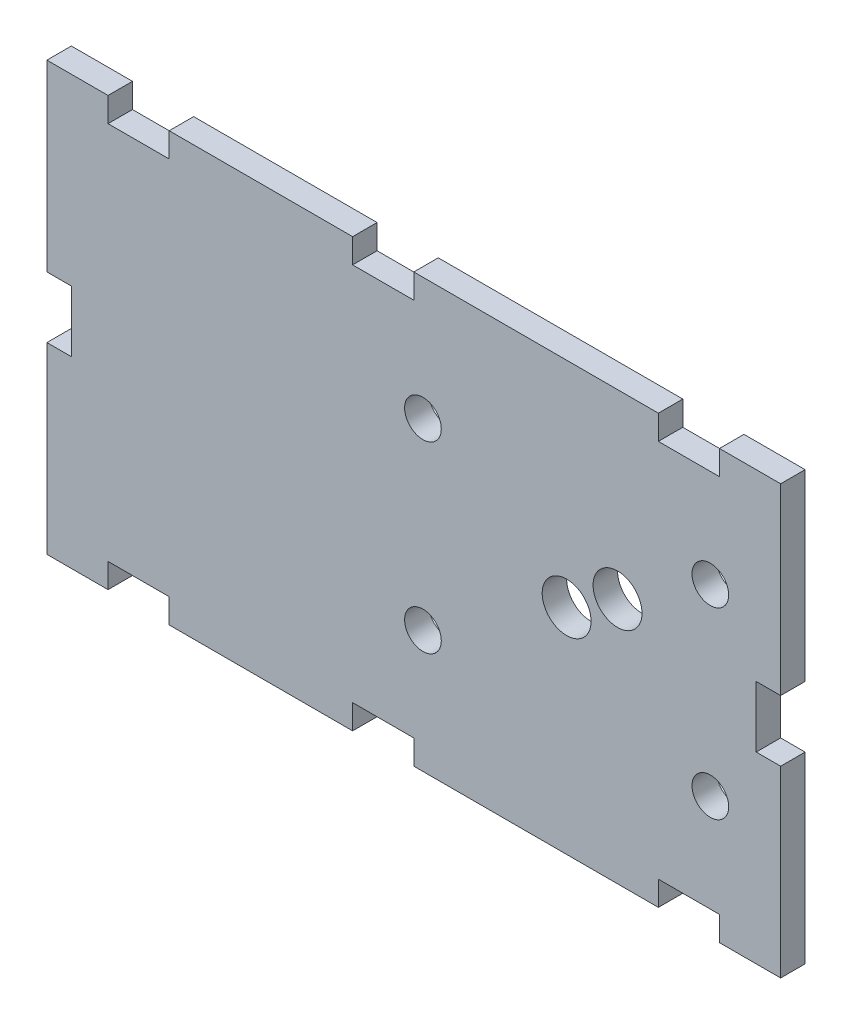
from build123d import *

# Parameters (mm, degrees)
SKETCH1_W           = 120
SKETCH1_H           = 70
BOSS_EXTRUDE1_DEPTH = 4
SKETCH2_R           = 4
SKETCH2_R_2         = 3
CUT_EXTRUDE1_DEPTH  = 4
SKETCH3_R           = 4
CUT_EXTRUDE2_DEPTH  = 4
SKETCH4_W           = 10
SKETCH4_H           = 4
SKETCH4_W_2         = 4
SKETCH4_H_2         = 10
CUT_EXTRUDE3_DEPTH  = 4


with BuildPart() as part:
    # Sketch1 → Boss-Extrude1 (new body)
    with BuildSketch(Plane.XY):
        with Locations((60, 35)):
            Rectangle(SKETCH1_W, SKETCH1_H)
    extrude(amount=BOSS_EXTRUDE1_DEPTH)

    # Sketch2 → Cut-Extrude1 (cut)
    with BuildSketch(Plane.XY.offset(4)):
        with Locations((85, 35)):
            Circle(SKETCH2_R)
        with Locations((108.5, 50)):
            Circle(SKETCH2_R_2)
        with Locations((108.5, 20)):
            Circle(SKETCH2_R_2)
        with Locations((61.5, 20)):
            Circle(SKETCH2_R_2)
        with Locations((61.5, 50)):
            Circle(SKETCH2_R_2)
    extrude(amount=-CUT_EXTRUDE1_DEPTH, mode=Mode.SUBTRACT)

    # Sketch3 → Cut-Extrude2 (cut)
    with BuildSketch(Plane.XY.offset(4)):
        with Locations((93.322796237, 40.31242313)):
            Circle(SKETCH3_R)
    extrude(amount=-CUT_EXTRUDE2_DEPTH, mode=Mode.SUBTRACT)

    # Sketch4 → Cut-Extrude3 (cut)
    with BuildSketch(Plane.XY.offset(4)):
        with Locations((15, 2)):
            Rectangle(SKETCH4_W, SKETCH4_H)
        with Locations((55, 2)):
            Rectangle(SKETCH4_W, SKETCH4_H)
        with Locations((2, 35)):
            Rectangle(SKETCH4_W_2, SKETCH4_H_2)
        with Locations((105, 2)):
            Rectangle(SKETCH4_W, SKETCH4_H)
        with Locations((15, 68)):
            Rectangle(SKETCH4_W, SKETCH4_H)
        with Locations((118, 35)):
            Rectangle(SKETCH4_W_2, SKETCH4_H_2)
        with Locations((55, 68)):
            Rectangle(SKETCH4_W, SKETCH4_H)
        with Locations((105, 68)):
            Rectangle(SKETCH4_W, SKETCH4_H)
    extrude(amount=-CUT_EXTRUDE3_DEPTH, mode=Mode.SUBTRACT)


solid = part.part
